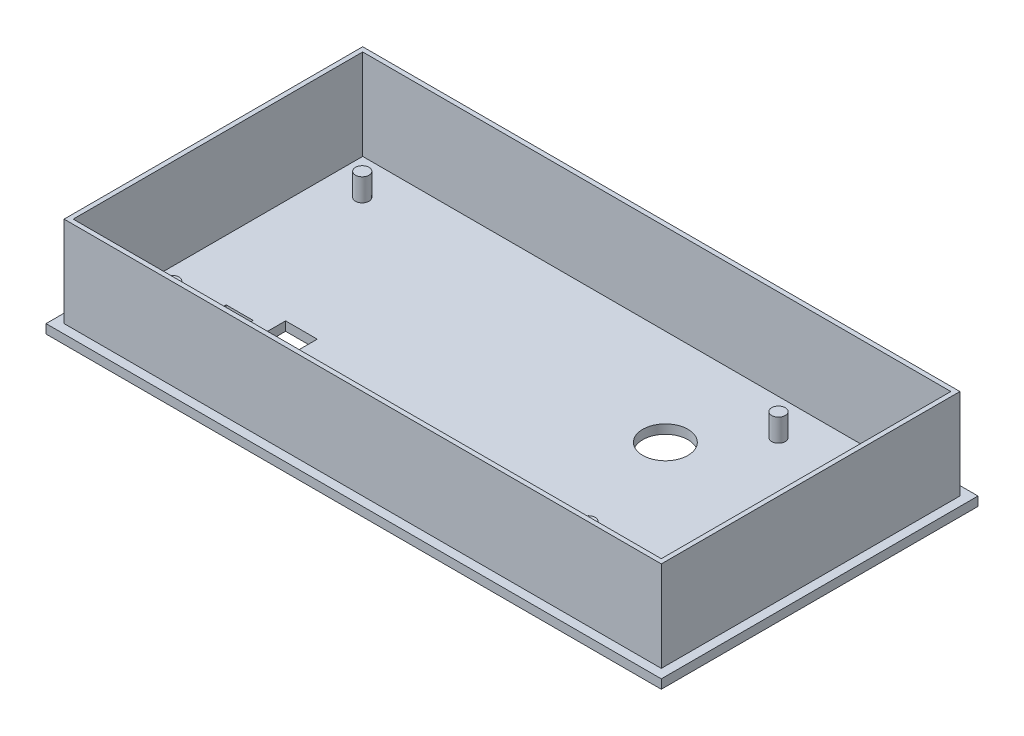
from build123d import *

# Parameters (mm, degrees)
SKETCH_1_W          = 136
SKETCH_1_H          = 70
EXTRUDE_1_DEPTH     = 2
SKETCH_2_W          = 132
SKETCH_2_H          = 66
SKETCH_2_W_2        = 130
SKETCH_2_H_2        = 64
EXTRUDE_2_DEPTH     = 20
SKETCH_3_R          = 1.5
EXTRUDE_3_DEPTH     = 5
SKETCH_5_R          = 5
CUT_EXTRUDE_2_DEPTH = 80.050616696
CUT_EXTRUDE_3_DEPTH = 80.050616696
CUT_EXTRUDE_4_DEPTH = 80.050616696


with BuildPart() as part:
    # 草图1 → 凸台-拉伸1 (new body)
    with BuildSketch(Plane(origin=(0, 0, 0), x_dir=(1, 0, 0), z_dir=(0, 1, 0))):
        Rectangle(SKETCH_1_W, SKETCH_1_H)
    extrude(amount=EXTRUDE_1_DEPTH)

    # 草图2 → 凸台-拉伸2 (add)
    with BuildSketch(Plane(origin=(0, 2, 0), x_dir=(1, 0, 0), z_dir=(0, 1, 0))):
        Rectangle(SKETCH_2_W, SKETCH_2_H)
        Rectangle(SKETCH_2_W_2, SKETCH_2_H_2, mode=Mode.SUBTRACT)
    extrude(amount=EXTRUDE_2_DEPTH)

    # 草图3 → 凸台-拉伸3 (add)
    with BuildSketch(Plane(origin=(0, 2, 0), x_dir=(1, 0, 0), z_dir=(0, 1, 0))):
        with Locations((-57.212778167, 24.109946255)):
            Circle(SKETCH_3_R)
        with Locations((-57.212778167, -17.890053745)):
            Circle(SKETCH_3_R)
        with Locations((34.787221833, -17.890053745)):
            Circle(SKETCH_3_R)
        with Locations((34.787221833, 24.109946255)):
            Circle(SKETCH_3_R)
    extrude(amount=EXTRUDE_3_DEPTH)

    # 草图5 → 切除-拉伸2 (cut, through all)
    with BuildSketch(Plane(origin=(0, 2, 0), x_dir=(1, 0, 0), z_dir=(0, 1, 0))):
        with Locations((23.178408015, 10.720944477)):
            Circle(SKETCH_5_R)
    extrude(amount=-CUT_EXTRUDE_2_DEPTH, mode=Mode.SUBTRACT)

    # 草图6 → 切除-拉伸3 (cut, through all)
    with BuildSketch(Plane(origin=(0, 2, 0), x_dir=(1, 0, 0), z_dir=(0, 1, 0))):
        Polygon((-51.700967144, -14.498130962), (-51.700967144, -11.498130962), (-45.700967144, -11.498130962), (-45.700967144, -17.498130962), (-51.700967144, -17.498130962), align=None)
    extrude(amount=-CUT_EXTRUDE_3_DEPTH, mode=Mode.SUBTRACT)

    # 草图7 → 切除-拉伸4 (cut, through all)
    with BuildSketch(Plane(origin=(0, 2, 0), x_dir=(1, 0, 0), z_dir=(0, 1, 0))):
        Polygon((-38.543740829, -7.998130962), (-42.043740829, -7.998130962), (-42.043740829, -20.998130962), (-35.043740829, -20.998130962), (-35.043740829, -7.998130962), align=None)
    extrude(amount=-CUT_EXTRUDE_4_DEPTH, mode=Mode.SUBTRACT)


solid = part.part
